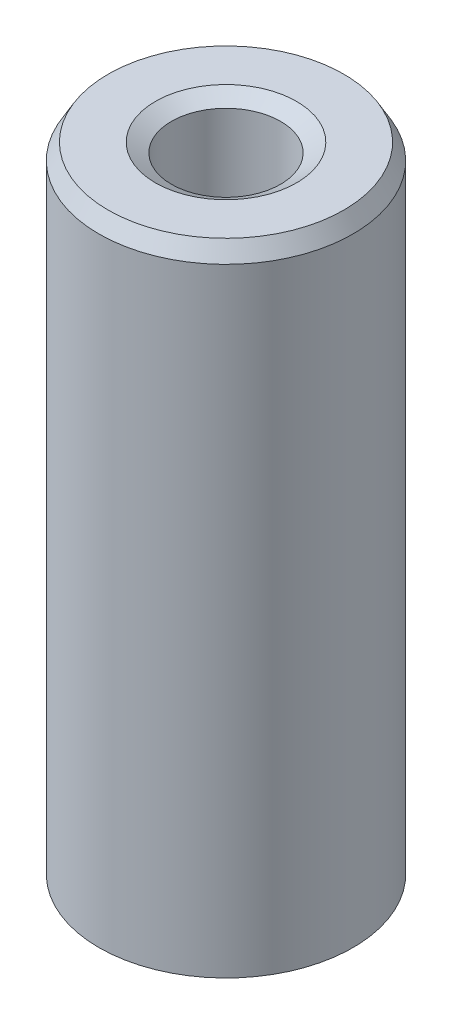
from build123d import *
from OCP.BRepFilletAPI import BRepFilletAPI_MakeChamfer

# Parameters (mm, degrees)
SKETCH1_R           = 20
BOSS_EXTRUDE1_DEPTH = 101.258589536
SKETCH2_R           = 8.589506175
CUT_EXTRUDE1_DEPTH  = 106.134684833
CHAMFER1_SIZE       = 2.523272192
CHAMFER1_SIZE2      = 1.456811879


with BuildPart() as part:
    # Sketch1 → Boss-Extrude1 (new body)
    with BuildSketch(Plane(origin=(0, 0, 0), x_dir=(1, 0, 0), z_dir=(0, 1, 0))):
        Circle(SKETCH1_R)
    extrude(amount=BOSS_EXTRUDE1_DEPTH)

    # Sketch2 → Cut-Extrude1 (cut, through all)
    with BuildSketch(Plane(origin=(0, 0, 0), x_dir=(1, 0, 0), z_dir=(0, 1, 0))):
        Circle(SKETCH2_R)
    extrude(amount=CUT_EXTRUDE1_DEPTH, mode=Mode.SUBTRACT)

    # Chamfer1: one chamfer whose edges measure the first distance from different faces: ONE call of the kernel's chamfer builder (chamfer() names one face for all edges)
    chamfer1_edges_1 = [part.edges().sort_by_distance(p)[0] for p in [
        (-8.589506175, 101.258589536, 0),
    ]]
    chamfer1_side_1 = [part.faces().sort_by_distance(p)[0] for p in [
        (-19.434314575, 101.258589536, 0),
    ]]
    chamfer1_edges_2 = [part.edges().sort_by_distance(p)[0] for p in [
        (-8.589506175, 0, 0),
    ]]
    chamfer1_side_2 = [part.faces().sort_by_distance(p)[0] for p in [
        (-8.589506175, 50.629294768, 0),
    ]]
    chamfer1_edges_3 = [part.edges().sort_by_distance(p)[0] for p in [
        (-20, 0, 0),
    ]]
    chamfer1_side_3 = [part.faces().sort_by_distance(p)[0] for p in [
        (-19.434314575, 0, 0),
    ]]
    chamfer1_edges_4 = [part.edges().sort_by_distance(p)[0] for p in [
        (-20, 101.258589536, 0),
    ]]
    chamfer1_side_4 = [part.faces().sort_by_distance(p)[0] for p in [
        (-20, 50.629294768, 0),
    ]]
    chamfer1 = BRepFilletAPI_MakeChamfer(part.part.solid().wrapped)
    for e in chamfer1_edges_1:
        chamfer1.Add(CHAMFER1_SIZE, CHAMFER1_SIZE2, e.wrapped, chamfer1_side_1[0].wrapped)  # the first distance lies on this face
    for e in chamfer1_edges_2:
        chamfer1.Add(CHAMFER1_SIZE, CHAMFER1_SIZE2, e.wrapped, chamfer1_side_2[0].wrapped)  # the first distance lies on this face
    for e in chamfer1_edges_3:
        chamfer1.Add(CHAMFER1_SIZE, CHAMFER1_SIZE2, e.wrapped, chamfer1_side_3[0].wrapped)  # the first distance lies on this face
    for e in chamfer1_edges_4:
        chamfer1.Add(CHAMFER1_SIZE, CHAMFER1_SIZE2, e.wrapped, chamfer1_side_4[0].wrapped)  # the first distance lies on this face
    add(Compound.cast(chamfer1.Shape()), mode=Mode.REPLACE)


solid = part.part
